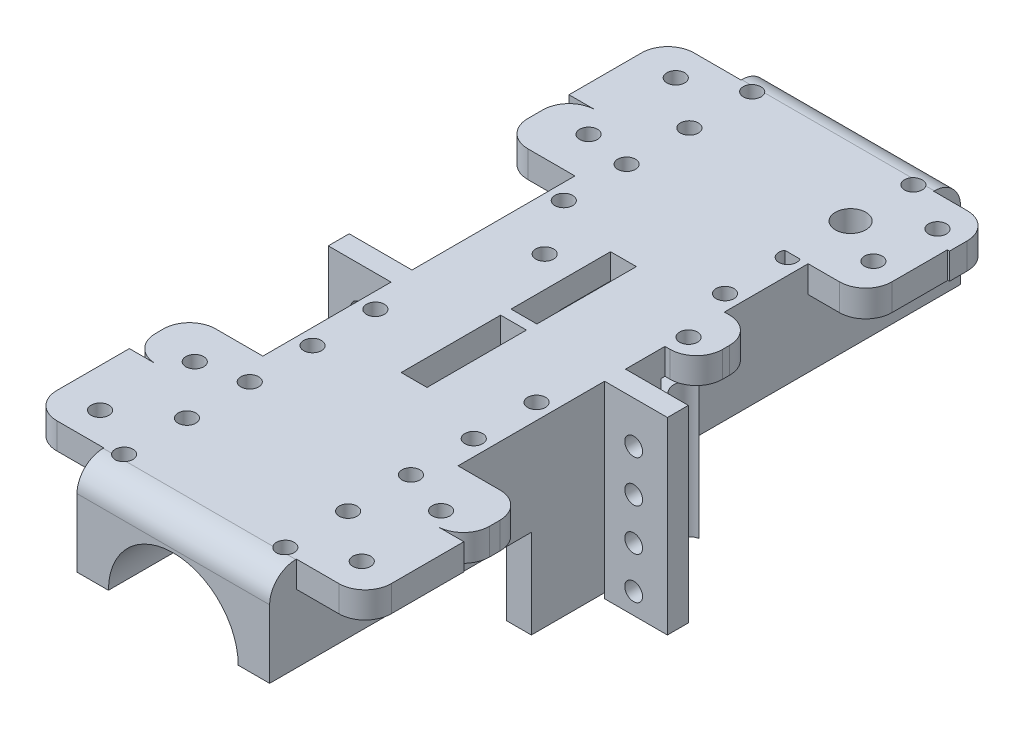
from build123d import *

# Parameters (mm, degrees)
BOSS_EXTRU_1_DEPTH       = 132
ESQUISSE3_W              = 4.94012132
ESQUISSE3_H              = 40
ENL_V_MAT_EXTRU_2_DEPTH  = 9
ESQUISSE4_R              = 1.7
ENL_V_MAT_EXTRU_3_DEPTH  = 18
BOSS_EXTRU_2_REACH       = 140.211
ESQUISSE7_W              = 2
ESQUISSE7_H              = 18
ENL_V_MAT_EXTRU_5_DEPTH  = 15
ENL_V_START              = 15
ENL_V_MAT_EXTRU_6_DEPTH  = 15
ESQUISSE10_W             = 5.625
ESQUISSE10_H             = 32
BOSS_EXTRU_3_DEPTH       = 17
ESQUISSE21_W             = 12.870650759
ESQUISSE21_H             = 5.1
ESQUISSE21_W_2           = 11.50577473
BOSS_EXTRU_7_DEPTH       = 14
ESQUISSE12_W             = 12
ESQUISSE12_H             = 8
BOSS_EXTRU_4_DEPTH       = 13
ESQUISSE14_W             = 11.349962924
ESQUISSE14_H             = 7.588006138
BOSS_EXTRU_5_DEPTH       = 6
ESQUISSE16_W             = 13.258712606
ESQUISSE16_H             = 4.272246905
ENL_V_MAT_EXTRU_7_DEPTH  = 11
BOSS_EXTRU_6_DEPTH       = 11
BOSS_EXTRU_6_DEPTH_BACK  = 11
ESQUISSE17_W             = 15.613345165
ESQUISSE17_H             = 5.100882875
ESQUISSE11_R             = 1.7
ESQUISSE11_R_2           = 1.3
ESQUISSE11_R_3           = 2.916438904
ENL_V_MAT_EXTRU_8_DEPTH  = 8
CONG_1_R                 = 5
ESQUISSE18_W             = 9.677736186
ESQUISSE18_H             = 8.253244783
ENL_V_MAT_EXTRU_9_DEPTH  = 10
CONG_2_R                 = 5
ESQUISSE19_W             = 139.450699615
ESQUISSE19_H             = 7.59460478
ENL_V_MAT_EXTRU_10_DEPTH = 24
ESQUISSE20_W             = 27.3
ESQUISSE20_H             = 40.032665724
ENL_V_MAT_EXTRU_11_DEPTH = 22
ESQUISSE22_R             = 2.780350547
ENL_V_MAT_EXTRU_12_DEPTH = 33
ENL_V_MAT_EXTRU_13_DEPTH = 23
ESQUISSE29_W             = 4
ESQUISSE29_H             = 36
BOSS_EXTRU_8_DEPTH       = 12
ESQUISSE30_W             = 4
ESQUISSE30_H             = 36
BOSS_EXTRU_9_DEPTH       = 12
ESQUISSE31_R             = 1.7
ENL_V_MAT_EXTRU_18_DEPTH = 12
ESQUISSE32_R             = 1.7
ENL_V_MAT_EXTRU_19_DEPTH = 12
ESQUISSE34_W             = 14
ESQUISSE34_H             = 18.870064929
ESQUISSE34_H_2           = 18.872361051
ESQUISSE34_W_2           = 13.107419587
ESQUISSE34_W_3           = 11.413970755
ESQUISSE34_H_3           = 8.373824251
BOSS_EXTRU_10_DEPTH      = 5
ESQUISSE33_R             = 1.7
ENL_V_MAT_EXTRU_20_DEPTH = 15
CONG_3_R                 = 5


with BuildPart() as part:
    # Esquisse1 → Boss.-Extru.1 (new body)
    with BuildSketch(Plane.XY):
        with BuildLine():
            Line((-12.4, 0), (-18.4, 0))
            Line((-18.4, 0), (-18.4, 18))
            Line((-18.4, 18), (18.4, 18))
            Line((18.4, 18), (18.4, 0))
            Line((18.4, 0), (12.4, 0))
            ThreePointArc((12.4, 0), (0, 12.4), (-12.4, 0))
        make_face()
    extrude(amount=BOSS_EXTRU_1_DEPTH)

    # Esquisse3 → Enlèv. mat.-Extru.2 (cut)
    with BuildSketch(Plane.XZ.offset(-18)):
        with Locations((0, 66)):
            Rectangle(ESQUISSE3_W, ESQUISSE3_H)
    extrude(amount=ENL_V_MAT_EXTRU_2_DEPTH, mode=Mode.SUBTRACT)

    # Esquisse4 → Enlèv. mat.-Extru.3 (cut)
    with BuildSketch(Plane(origin=(0, 18, 0), x_dir=(1, 0, 0), z_dir=(0, 1, 0))):
        with Locations(Location((15.4, -6, 0), (0, 0, 270))):
            Circle(ESQUISSE4_R)
        with Locations(Location((15.4, -18, 0), (0, 0, 270))):
            Circle(ESQUISSE4_R)
        with Locations(Location((-15.4, -6, 0), (0, 0, 90))):
            Circle(ESQUISSE4_R)
        with Locations(Location((-15.4, -18, 0), (0, 0, 90))):
            Circle(ESQUISSE4_R)
        with Locations(Location((15.4, -30, 0), (0, 0, 270))):
            Circle(ESQUISSE4_R)
        with Locations(Location((-15.4, -30, 0), (0, 0, 90))):
            Circle(ESQUISSE4_R)
        with Locations(Location((15.4, -42, 0), (0, 0, 270))):
            Circle(ESQUISSE4_R)
        with Locations(Location((-15.4, -42, 0), (0, 0, 90))):
            Circle(ESQUISSE4_R)
        with Locations(Location((-15.4, -126, 0), (0, 0, 270))):
            Circle(ESQUISSE4_R)
        with Locations(Location((-15.4, -114, 0), (0, 0, 270))):
            Circle(ESQUISSE4_R)
        with Locations(Location((-15.4, -102, 0), (0, 0, 270))):
            Circle(ESQUISSE4_R)
        with Locations(Location((-15.4, -90, 0), (0, 0, 270))):
            Circle(ESQUISSE4_R)
        with Locations(Location((-15.4, -78, 0), (0, 0, 270))):
            Circle(ESQUISSE4_R)
        with Locations(Location((15.4, -78, 0), (0, 0, 90))):
            Circle(ESQUISSE4_R)
        with Locations(Location((15.4, -90, 0), (0, 0, 90))):
            Circle(ESQUISSE4_R)
        with Locations(Location((15.4, -102, 0), (0, 0, 90))):
            Circle(ESQUISSE4_R)
        with Locations(Location((15.4, -114, 0), (0, 0, 90))):
            Circle(ESQUISSE4_R)
        with Locations(Location((15.4, -126, 0), (0, 0, 90))):
            Circle(ESQUISSE4_R)
    extrude(amount=-ENL_V_MAT_EXTRU_3_DEPTH, mode=Mode.SUBTRACT)

    # Esquisse7 → Boss.-Extru.2 (add, up to next)
    with BuildSketch(Plane.ZY.offset(18.4), mode=Mode.PRIVATE) as boss_extru_2_sk1:
        with Locations((66, 9)):
            Rectangle(ESQUISSE7_W, ESQUISSE7_H)
    boss_extru_2_tool1 = extrude(boss_extru_2_sk1.sketch, amount=-BOSS_EXTRU_2_REACH, mode=Mode.PRIVATE) - part.part
    add(boss_extru_2_tool1.solids().sort_by_distance((-18.4, 9, 66))[0])

    # Esquisse8 → Enlèv. mat.-Extru.5 (cut)
    with BuildSketch(Plane(origin=(0, 0, 65), x_dir=(-1, 0, 0), z_dir=(0, 0, -1))):
        with BuildLine():
            Line((12.775, 0), (-12.775, 0))
            ThreePointArc((-12.775, 0), (0, 12.775), (12.775, 0))
        make_face()
    extrude(amount=ENL_V_MAT_EXTRU_5_DEPTH, mode=Mode.SUBTRACT)

    # Esquisse9 → Enlèv. mat.-Extru.6 (cut)
    with BuildSketch(Plane.XY.offset(67).offset(ENL_V_START)):
        with BuildLine():
            Line((12.775, 0), (-12.775, 0))
            ThreePointArc((-12.775, 0), (0, 12.775), (12.775, 0))
        make_face()
    extrude(amount=-ENL_V_MAT_EXTRU_6_DEPTH, mode=Mode.SUBTRACT)

    # Esquisse10 → Boss.-Extru.3 (add)
    with BuildSketch(Plane.XZ):
        with Locations((15.5875, 66)):
            Rectangle(ESQUISSE10_W, ESQUISSE10_H)
        with Locations((-15.5875, 66)):
            Rectangle(ESQUISSE10_W, ESQUISSE10_H)
    extrude(amount=BOSS_EXTRU_3_DEPTH)

    # Esquisse21 → Boss.-Extru.7 (add)
    with BuildSketch(Plane.ZY.offset(18.4)):
        with Locations((30.43532538, 15.45)):
            Rectangle(ESQUISSE21_W, ESQUISSE21_H)
        with Locations((102.247112635, 15.45)):
            Rectangle(ESQUISSE21_W_2, ESQUISSE21_H)
    extrude(amount=BOSS_EXTRU_7_DEPTH)

    # Esquisse12 → Boss.-Extru.4 (add)
    with BuildSketch(Plane(origin=(18.4, 0, 0), x_dir=(0, 0, -1), z_dir=(1, 0, 0))):
        with Locations((-102, 14)):
            Rectangle(ESQUISSE12_W, ESQUISSE12_H)
    extrude(amount=BOSS_EXTRU_4_DEPTH)

    # Esquisse14 → Boss.-Extru.5 (add)
    with BuildSketch(Plane(origin=(18.4, 0, 0), x_dir=(0, 0, -1), z_dir=(1, 0, 0))):
        with Locations((-50.7944077, 14.205996931)):
            Rectangle(ESQUISSE14_W, ESQUISSE14_H)
    extrude(amount=BOSS_EXTRU_5_DEPTH)

    # Esquisse16 → Enlèv. mat.-Extru.7 (cut)
    with BuildSketch(Plane(origin=(24.4, 0, 0), x_dir=(0, 0, -1), z_dir=(1, 0, 0))):
        with Locations((-50.566594151, 10.91391733)):
            Rectangle(ESQUISSE16_W, ESQUISSE16_H)
    extrude(amount=-ENL_V_MAT_EXTRU_7_DEPTH, mode=Mode.SUBTRACT)

    # Esquisse17 → Boss.-Extru.6 (add, two sides: drawn at the far end of the back side and taken through both)
    with BuildSketch(Plane(origin=(18.4, 0, 0), x_dir=(0, 0, -1), z_dir=(1, 0, 0)).offset(-BOSS_EXTRU_6_DEPTH_BACK)):
        with Locations((-21.308135783, 15.449558563)):
            Rectangle(ESQUISSE17_W, ESQUISSE17_H)
    extrude(amount=BOSS_EXTRU_6_DEPTH + BOSS_EXTRU_6_DEPTH_BACK)

    # Esquisse11 → Enlèv. mat.-Extru.8 (cut)
    with BuildSketch(Plane(origin=(0, 18, 0), x_dir=(1, 0, 0), z_dir=(0, 1, 0))):
        with Locations(Location((24.22, -105.065455989, 0), (0, 0, 270))):
            Circle(ESQUISSE11_R)
        with Locations(Location((19.13, -52.682438015, 0), (0, 0, 270))):
            Circle(ESQUISSE11_R)
        with Locations(Location((24.22, -22.462438015, 0), (0, 0, 270))):
            Circle(ESQUISSE11_R)
        with Locations(Location((-8.37, -52.682438015, 0), (0, 0, 270))):
            Circle(ESQUISSE11_R)
        with Locations((15.4, -6)):
            Circle(ESQUISSE11_R_2)
        with Locations(Location((15.4, -18, 0), (0, 0, 270))):
            Circle(ESQUISSE11_R_3)
        with Locations(Location((-23.98, -103.922438015, 0), (0, 0, 270))):
            Circle(ESQUISSE11_R)
        with Locations(Location((-23.98, -28.682438015, 0), (0, 0, 270))):
            Circle(ESQUISSE11_R)
    extrude(amount=-ENL_V_MAT_EXTRU_8_DEPTH, mode=Mode.SUBTRACT)

    # Congé1
    cong_1_edges = [part.edges().sort_by_distance(p)[0] for p in [
        (24.4, 15.525020391, 45.119426238),
        (24.4, 15.525020391, 56.469389162),
        (31.4, 14, 96),
        (31.4, 14, 108),
        (29.4, 15.449558563, 29.114808365),
        (-32.4, 15.45, 108),
        (-32.4, 15.45, 96.49422527),
        (-32.4, 15.45, 36.870650759),
        (-32.4, 15.45, 24),
    ]]
    fillet(cong_1_edges, radius=CONG_1_R)

    # Esquisse18 → Enlèv. mat.-Extru.9 (cut)
    with BuildSketch(Plane(origin=(-2.47006066, 0, 0), x_dir=(0, 0, -1), z_dir=(1, 0, 0))):
        with Locations((-50.900131157, 9.01339788)):
            Rectangle(ESQUISSE18_W, ESQUISSE18_H)
    extrude(amount=-ENL_V_MAT_EXTRU_9_DEPTH, mode=Mode.SUBTRACT)

    # Congé2
    # the kernel refuses this fillet: 5 mm, written as the material it takes off along each edge
    with BuildSketch(Plane(origin=(-30.9, 18, 0), x_dir=(0, 0, 1), z_dir=(1, 0, 0))) as cong_2_piece_1:
        with BuildLine():
            CenterArc((CONG_2_R, CONG_2_R), CONG_2_R, 180, 90)
            Line((0, CONG_2_R), (0, 0))
            Line((0, 0), (CONG_2_R, 0))
        make_face()
    extrude(amount=61.8, mode=Mode.SUBTRACT)
    with BuildSketch(Plane(origin=(-30.9, 18, 132), x_dir=(0, 0, -1), z_dir=(1, 0, 0))) as cong_2_piece_2:
        with BuildLine():
            CenterArc((CONG_2_R, -CONG_2_R), CONG_2_R, 90, 90)
            Line((0, -CONG_2_R), (0, 0))
            Line((0, 0), (CONG_2_R, 0))
        make_face()
    extrude(amount=61.8, mode=Mode.SUBTRACT)

    # Esquisse19 → Enlèv. mat.-Extru.10 (cut)
    with BuildSketch(Plane(origin=(18.4, 0, 0), x_dir=(0, 0, -1), z_dir=(1, 0, 0))):
        with Locations((-62.274650192, 9.101814735)):
            Rectangle(ESQUISSE19_W, ESQUISSE19_H)
    extrude(amount=ENL_V_MAT_EXTRU_10_DEPTH, mode=Mode.SUBTRACT)

    # Esquisse20 → Enlèv. mat.-Extru.11 (cut)
    with BuildSketch(Plane.XZ):
        with Locations((0, 66)):
            Rectangle(ESQUISSE20_W, ESQUISSE20_H)
    extrude(amount=ENL_V_MAT_EXTRU_11_DEPTH, mode=Mode.SUBTRACT)

    # Esquisse22 → Enlèv. mat.-Extru.12 (cut)
    with BuildSketch(Plane.XZ.offset(-13.050040782)):
        with Locations((19.13, 52.682438015)):
            Circle(ESQUISSE22_R)
    extrude(amount=ENL_V_MAT_EXTRU_12_DEPTH, mode=Mode.SUBTRACT)

    # Esquisse23 → Enlèv. mat.-Extru.13 (cut)
    with BuildSketch(Plane.XZ.offset(-13.140020271)):
        Polygon((-10.962659815, 54.736061467), (-30.574521602, 60.209177611), (-30.574521602, 54.651975737), (-10.962659815, 50.396101529), align=None)
    extrude(amount=ENL_V_MAT_EXTRU_13_DEPTH, mode=Mode.SUBTRACT)

    # Esquisse29 → Boss.-Extru.8 (add)
    with BuildSketch(Plane(origin=(18.4, 0, 0), x_dir=(0, 0, -1), z_dir=(1, 0, 0))):
        with Locations((-66, 0)):
            Rectangle(ESQUISSE29_W, ESQUISSE29_H)
    extrude(amount=BOSS_EXTRU_8_DEPTH)

    # Esquisse30 → Boss.-Extru.9 (add)
    with BuildSketch(Plane.ZY.offset(18.4)):
        with Locations((70, 0)):
            Rectangle(ESQUISSE30_W, ESQUISSE30_H)
    extrude(amount=BOSS_EXTRU_9_DEPTH)

    # Esquisse31 → Enlèv. mat.-Extru.18 (cut)
    with BuildSketch(Plane.XY.offset(68)):
        with Locations((23.954865258, 10)):
            Circle(ESQUISSE31_R)
        with Locations((23.954865258, 2)):
            Circle(ESQUISSE31_R)
        with Locations((23.954865258, -6)):
            Circle(ESQUISSE31_R)
        with Locations((23.954865258, -14)):
            Circle(ESQUISSE31_R)
    extrude(amount=-ENL_V_MAT_EXTRU_18_DEPTH, mode=Mode.SUBTRACT)

    # Esquisse32 → Enlèv. mat.-Extru.19 (cut)
    with BuildSketch(Plane.XY.offset(72)):
        with Locations((-24.4, 10)):
            Circle(ESQUISSE32_R)
        with Locations((-24.4, 2)):
            Circle(ESQUISSE32_R)
        with Locations((-24.4, -6)):
            Circle(ESQUISSE32_R)
        with Locations((-24.4, -14)):
            Circle(ESQUISSE32_R)
    extrude(amount=-ENL_V_MAT_EXTRU_19_DEPTH, mode=Mode.SUBTRACT)

    # Esquisse34 → Boss.-Extru.10 (add)
    with BuildSketch(Plane(origin=(0, 18, 0), x_dir=(1, 0, 0), z_dir=(0, 1, 0))):
        with Locations((-25.4, -117.435032465)):
            Rectangle(ESQUISSE34_W, ESQUISSE34_H)
        with Locations((-25.4, -14.563819475)):
            Rectangle(ESQUISSE34_W, ESQUISSE34_H_2)
        with Locations((24.953709794, -117.435032465)):
            Rectangle(ESQUISSE34_W_2, ESQUISSE34_H)
        with Locations((24.106985378, -9.314551075)):
            Rectangle(ESQUISSE34_W_3, ESQUISSE34_H_3)
    extrude(amount=-BOSS_EXTRU_10_DEPTH)

    # Esquisse33 → Enlèv. mat.-Extru.20 (cut)
    with BuildSketch(Plane(origin=(0, 18, 0), x_dir=(1, 0, 0), z_dir=(0, 1, 0))):
        with Locations(Location((-25, -121, 0), (0, 0, 270))):
            Circle(ESQUISSE33_R)
        with Locations(Location((25, -121, 0), (0, 0, 270))):
            Circle(ESQUISSE33_R)
        with Locations(Location((25, -11, 0), (0, 0, 270))):
            Circle(ESQUISSE33_R)
        with Locations(Location((-25, -11, 0), (0, 0, 270))):
            Circle(ESQUISSE33_R)
    extrude(amount=-ENL_V_MAT_EXTRU_20_DEPTH, mode=Mode.SUBTRACT)

    # Congé3
    cong_3_edges = [part.edges().sort_by_distance(p)[0] for p in [
        (-32.4, 15.5, 126.870064929),
        (-32.4, 15.5, 5.127638949),
        (31.507419587, 15.5, 126.870064929),
        (29.813970755, 15.5, 5.127638949),
    ]]
    fillet(cong_3_edges, radius=CONG_3_R)


solid = part.part
